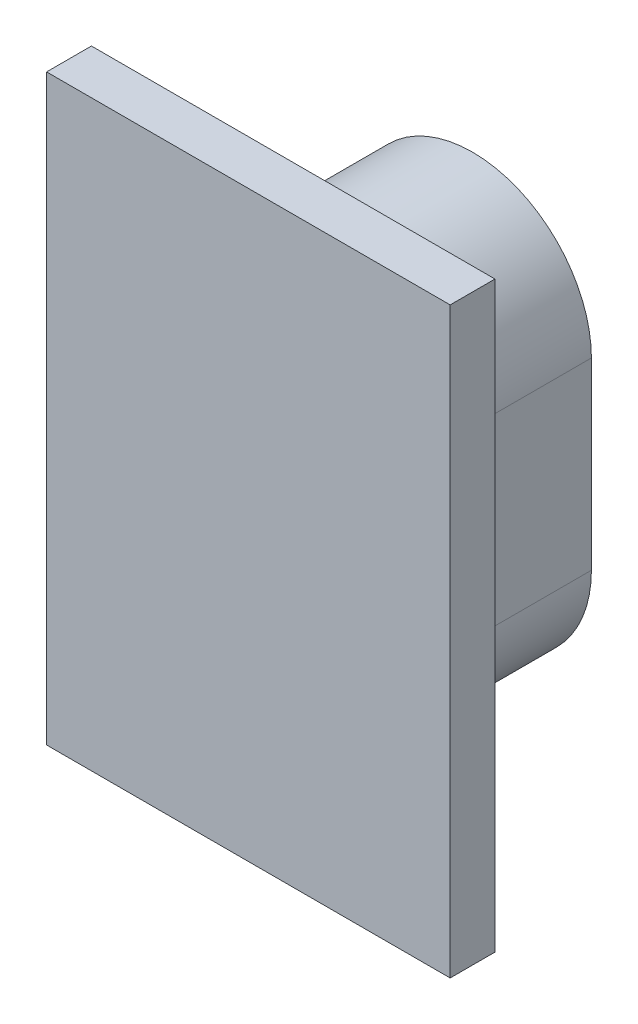
from build123d import *

# Parameters (mm, degrees)
SKETCH1_W           = 45
SKETCH1_H           = 65
BOSS_EXTRUDE1_DEPTH = 5
BOSS_EXTRUDE2_DEPTH = 20


with BuildPart() as part:
    # Sketch1 → Boss-Extrude1 (new body)
    with BuildSketch(Plane.XY):
        with Locations((2.886207951, -16.286739239)):
            Rectangle(SKETCH1_W, SKETCH1_H)
    extrude(amount=BOSS_EXTRUDE1_DEPTH)

    # Sketch4 → Boss-Extrude2 (add)
    with BuildSketch(Plane(origin=(0, 0, 0), x_dir=(-1, 0, 0), z_dir=(0, 0, -1))):
        with BuildLine():
            Line((10.363792049, -6.036739239), (10.363792049, -26.536739239))
            ThreePointArc((10.363792049, -26.536739239), (-2.886207951, -39.786739239), (-16.136207951, -26.536739239))
            Line((-16.136207951, -26.536739239), (-16.136207951, -6.036739239))
            ThreePointArc((-16.136207951, -6.036739239), (-2.886207951, 7.213260761), (10.363792049, -6.036739239))
        make_face()
        with BuildLine():
            Line((7.863792049, -6.036739239), (7.863792049, -26.536739239))
            ThreePointArc((7.863792049, -26.536739239), (-2.886207951, -37.286739239), (-13.636207951, -26.536739239))
            Line((-13.636207951, -26.536739239), (-13.636207951, -6.036739239))
            ThreePointArc((-13.636207951, -6.036739239), (-2.886207951, 4.713260761), (7.863792049, -6.036739239))
        make_face(mode=Mode.SUBTRACT)
    extrude(amount=BOSS_EXTRUDE2_DEPTH)


solid = part.part
